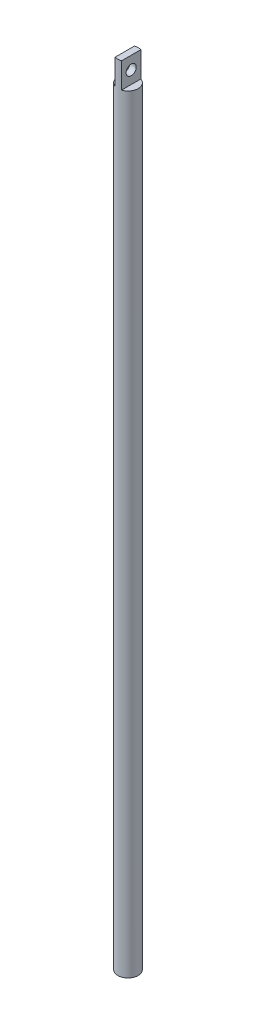
from build123d import *

# Parameters (mm, degrees)
SKETCH_1_R           = 8
EXTRUDE_1_DEPTH      = 15
SKETCH_2_R           = 8
EXTRUDE_2_DEPTH      = 610
SKETCH_3_OUTSIDE_W   = 143.082
SKETCH_3_OUTSIDE_H   = 143.082
SKETCH_3_OUTSIDE_W_2 = 5
SKETCH_3_OUTSIDE_H_2 = 20
CUT_EXTRUDE_1_DEPTH  = 20
SKETCH_4_R           = 4
CUT_EXTRUDE_2_DEPTH  = 20


with BuildPart() as part:
    # 草图1 → 凸台-拉伸1 (new body)
    with BuildSketch(Plane(origin=(0, 0, 0), x_dir=(1, 0, 0), z_dir=(0, 1, 0))):
        Circle(SKETCH_1_R)
    extrude(amount=EXTRUDE_1_DEPTH)

    # 草图2 → 凸台-拉伸2 (add)
    with BuildSketch(Plane(origin=(0, 15, 0), x_dir=(1, 0, 0), z_dir=(0, 1, 0))):
        Circle(SKETCH_2_R)
    extrude(amount=EXTRUDE_2_DEPTH)

    # 草图3 outside → 切除-拉伸1 (cut)
    with BuildSketch(Plane(origin=(0, 625, 0), x_dir=(1, 0, 0), z_dir=(0, 1, 0))):
        Rectangle(SKETCH_3_OUTSIDE_W, SKETCH_3_OUTSIDE_H)
        Rectangle(SKETCH_3_OUTSIDE_W_2, SKETCH_3_OUTSIDE_H_2, mode=Mode.SUBTRACT)
    extrude(amount=-CUT_EXTRUDE_1_DEPTH, mode=Mode.SUBTRACT)

    # 草图4 → 切除-拉伸2 (cut)
    with BuildSketch(Plane.ZY.offset(2.5)):
        with Locations((0, 615)):
            Circle(SKETCH_4_R)
    extrude(amount=-CUT_EXTRUDE_2_DEPTH, mode=Mode.SUBTRACT)


solid = part.part
